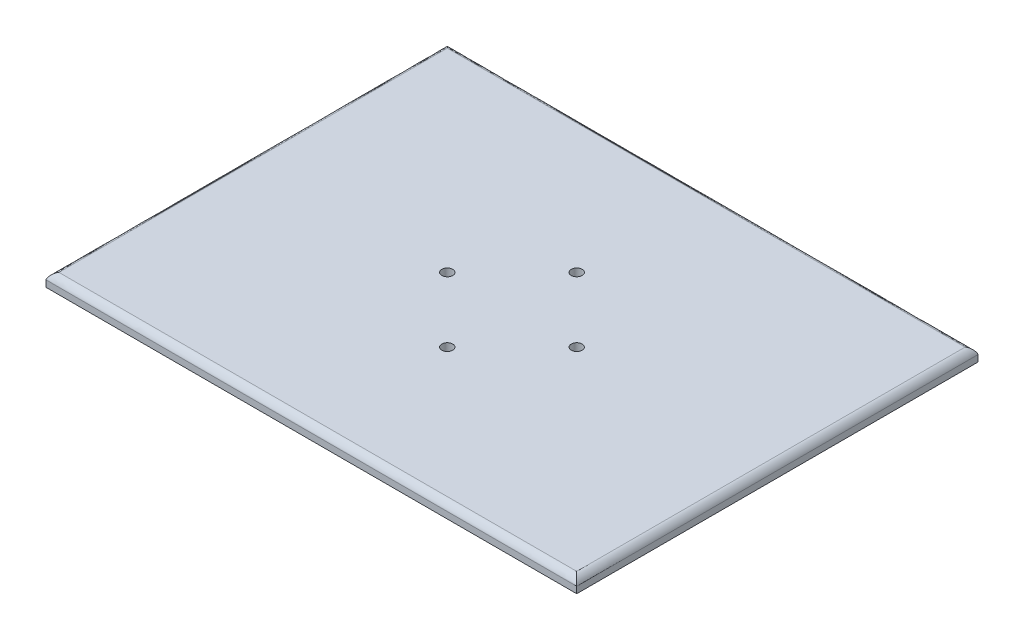
from build123d import *

# Parameters (mm, degrees)
CROQUIS1_W                                   = 205
CROQUIS1_H                                   = 155
SALIENTE_EXTRUIR1_DEPTH                      = 5
REDONDEO1_DEPTH                              = 205
REDONDEO1_START                              = -156
REDONDEO1_2_DEPTH                            = 157
CROQUIS2_R                                   = 1.5
CORTAR_EXTRUIR1_DEPTH                        = 3
PERFORADOR_PARA_ROSCAR_HELICOIL_DE_M41_D     = 4.2
PERFORADOR_PARA_ROSCAR_HELICOIL_DE_M41_DEPTH = 3.25
PERFORADOR_PARA_ROSCAR_HELICOIL_DE_M41_TIP   = 1.2618073


with BuildPart() as part:
    # Croquis1 → Saliente-Extruir1 (new body)
    with BuildSketch(Plane(origin=(0, 0, 0), x_dir=(1, 0, 0), z_dir=(0, 1, 0))):
        with Locations((102.5, 77.5)):
            Rectangle(CROQUIS1_W, CROQUIS1_H)
    extrude(amount=SALIENTE_EXTRUIR1_DEPTH)

    # Redondeo1: read off the stored shape, not the designer's step
    # Redondeo1 outline → Redondeo1 (cut)
    with BuildSketch(Plane.YZ):
        with BuildLine():
            Line((5, -155), (5, -152.5))
            add(Edge.make_bspline(
                [(5, -152.5), (5, -155), (2.5, -155)],
                knots=[0, 0, 0, 1, 1, 1], degree=2, weights=[1, 0.353553391, 1]))
            Line((2.5, -155), (5, -155))
        make_face()
        with BuildLine():
            add(Edge.make_bspline(
                [(5, -2.5), (5, 0), (2.5, 0)],
                knots=[0, 0, 0, 1, 1, 1], degree=2, weights=[1, 0.353553391, 1]))
            Line((5, -2.5), (5, 0))
            Line((5, 0), (2.5, 0))
        make_face()
    extrude(amount=REDONDEO1_DEPTH, mode=Mode.SUBTRACT)

    # Redondeo1 2 outline → Redondeo1 2 (cut)
    with BuildSketch(Plane.XY.offset(REDONDEO1_START)):
        with BuildLine():
            Line((205, 5), (202.5, 5))
            add(Edge.make_bspline(
                [(202.5, 5), (205, 5), (205, 2.5)],
                knots=[0, 0, 0, 1, 1, 1], degree=2, weights=[1, 0.353553391, 1]))
            Line((205, 2.5), (205, 5))
        make_face()
        with BuildLine():
            add(Edge.make_bspline(
                [(2.5, 5), (0, 5), (0, 2.5)],
                knots=[0, 0, 0, 1, 1, 1], degree=2, weights=[1, 0.353553391, 1]))
            Line((2.5, 5), (0, 5))
            Line((0, 5), (0, 2.5))
        make_face()
    extrude(amount=REDONDEO1_2_DEPTH, mode=Mode.SUBTRACT)

    # Croquis2 → Cortar-Extruir1 (cut)
    with BuildSketch(Plane(origin=(0, 5, 0), x_dir=(1, 0, 0), z_dir=(0, 1, 0))):
        with Locations(Location((77.5, 77.5, 0), (0, 0, 270))):
            Circle(CROQUIS2_R)
        with Locations(Location((102.5, 102.5, 0), (0, 0, 270))):
            Circle(CROQUIS2_R)
        with Locations(Location((127.5, 77.5, 0), (0, 0, 270))):
            Circle(CROQUIS2_R)
        with Locations(Location((102.5, 52.5, 0), (0, 0, 270))):
            Circle(CROQUIS2_R)
    extrude(amount=-CORTAR_EXTRUIR1_DEPTH, mode=Mode.SUBTRACT)

    # Perforador para roscar Helicoil de M41
    with Locations(Plane(origin=(0, 5, 0), x_dir=(1, 0, 0), z_dir=(0, 1, 0))):
        with Locations((77.5, 77.5), (102.5, 102.5), (127.5, 77.5), (102.5, 52.5)):
            Hole(PERFORADOR_PARA_ROSCAR_HELICOIL_DE_M41_D / 2, depth=PERFORADOR_PARA_ROSCAR_HELICOIL_DE_M41_DEPTH)
            with Locations((0, 0, -(PERFORADOR_PARA_ROSCAR_HELICOIL_DE_M41_DEPTH + PERFORADOR_PARA_ROSCAR_HELICOIL_DE_M41_TIP / 2))):  # 118° drill point
                Cone(0, PERFORADOR_PARA_ROSCAR_HELICOIL_DE_M41_D / 2, PERFORADOR_PARA_ROSCAR_HELICOIL_DE_M41_TIP, mode=Mode.SUBTRACT)


solid = part.part
